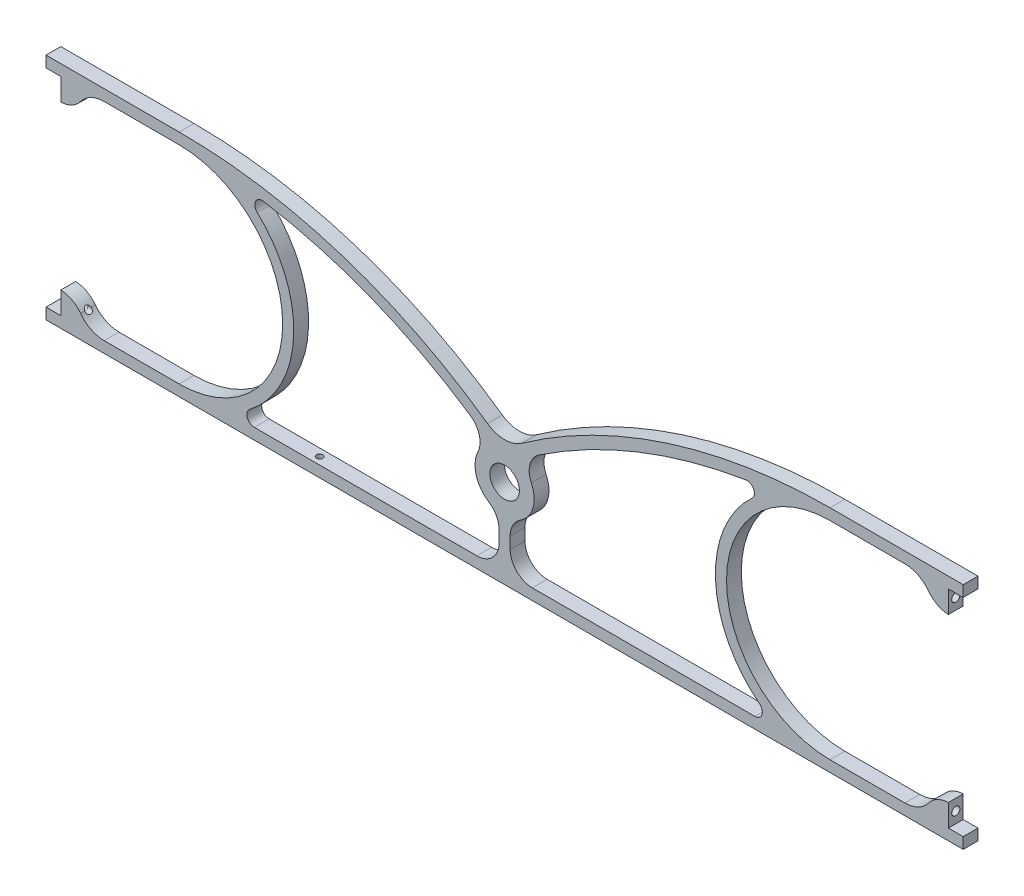
from build123d import *

# Parameters (mm, degrees)
SKETCH1_W                      = 6.35
SKETCH1_H                      = 4.7625
SKETCH1_R                      = 12.7
SKETCH1_R_2                    = 6.35
BOSS_EXTRUDE1_DEPTH            = 6.35
SKETCH2_W                      = 6.35
SKETCH2_H                      = 9.525
BOSS_EXTRUDE2_DEPTH            = 6.35
FILLET1_R                      = 12.7
FILLET2_R                      = 11.1125
F_6_32_TAPPED_HOLE1_D          = 2.7051
F_6_32_TAPPED_HOLE1_DEPTH      = 9.398
F_6_32_TAPPED_HOLE1_TIP        = 0.81269403
FILLET3_R                      = 9.525
FILLET4_R                      = 12.7
F_6_32_TAPPED_HOLE2_AT_2_COUNT = 2
F_6_32_TAPPED_HOLE2_AT_2_PITCH = 79.375
FILLET5_R                      = 3.175


with BuildPart() as part:
    # Sketch1 → Boss-Extrude1 (new body)
    # profile 1 of 11: a face of its own
    with BuildSketch(Plane.XY):
        with Locations((-193.675, -35.71875)):
            Rectangle(SKETCH1_W, SKETCH1_H)
    # profile 2 of 11: a face of its own
    with BuildSketch(Plane.XY):
        with Locations((-193.675, 57.94375)):
            Rectangle(SKETCH1_W, SKETCH1_H)
    # profile 3 of 11: a face of its own
    with BuildSketch(Plane.XY):
        with BuildLine():
            Line((-190.5, 55.5625), (-139.7, 55.5625))
            ThreePointArc((-139.7, 55.5625), (-127.904529217, 55.251640636), (-116.141805402, 54.31992556))
            ThreePointArc((-116.141805402, 54.31992556), (-58.142540048, 40.183298939), (-5.938839164, 11.225871431))
            ThreePointArc((-5.938839164, 11.225871431), (-3.059528789, 12.325959743), (0, 12.7))
            ThreePointArc((0, 12.7), (-65.90259045, 48.091568013), (-139.7, 60.325))
            Line((-139.7, 60.325), (-190.5, 60.325))
            Line((-190.5, 60.325), (-190.5, 55.5625))
        make_face()
    # profile 4 of 11: a face of its own
    with BuildSketch(Plane.XY):
        with BuildLine():
            ThreePointArc((-139.7, 55.5625), (-95.25, 11.1125), (-139.7, -33.3375))
            Line((-139.7, -33.3375), (-118.579686171, -33.3375))
            ThreePointArc((-118.579686171, -33.3375), (-90.506521339, 9.744357657), (-116.141805402, 54.31992556))
            ThreePointArc((-116.141805402, 54.31992556), (-127.904529217, 55.251640636), (-139.7, 55.5625))
        make_face()
    # profile 5 of 11: a face of its own
    with BuildSketch(Plane.XY):
        Polygon((190.5, -38.1), (190.5, -33.3375), (-118.579686171, -33.3375), (-190.5, -33.3375), (-190.5, -38.1), align=None)
    # profile 6 of 11: a face of its own
    with BuildSketch(Plane.XY):
        Circle(SKETCH1_R)
        Circle(SKETCH1_R_2, mode=Mode.SUBTRACT)
    # profile 7 of 11: a face of its own
    with BuildSketch(Plane.XY):
        with BuildLine():
            Line((-2.38125, -33.3375), (2.38125, -33.3375))
            Line((2.38125, -33.3375), (2.38125, -12.474760456))
            ThreePointArc((2.38125, -12.474760456), (0, -12.7), (-2.38125, -12.474760456))
            Line((-2.38125, -12.474760456), (-2.38125, -33.3375))
        make_face()
    # profile 8 of 11: a face of its own
    with BuildSketch(Plane.XY):
        with BuildLine():
            ThreePointArc((116.141805402, 54.31992556), (127.904529217, 55.251640636), (139.7, 55.5625))
            Line((139.7, 55.5625), (190.5, 55.5625))
            Line((190.5, 55.5625), (190.5, 60.325))
            Line((190.5, 60.325), (139.7, 60.325))
            ThreePointArc((139.7, 60.325), (65.90259045, 48.091568013), (0, 12.7))
            ThreePointArc((0, 12.7), (3.059528789, 12.325959743), (5.938839164, 11.225871431))
            ThreePointArc((5.938839164, 11.225871431), (58.142540048, 40.183298939), (116.141805402, 54.31992556))
        make_face()
    # profile 9 of 11: a face of its own
    with BuildSketch(Plane.XY):
        with BuildLine():
            Line((118.579686171, -33.3375), (139.7, -33.3375))
            ThreePointArc((139.7, -33.3375), (95.25, 11.1125), (139.7, 55.5625))
            ThreePointArc((139.7, 55.5625), (127.904529217, 55.251640636), (116.141805402, 54.31992556))
            ThreePointArc((116.141805402, 54.31992556), (90.506521339, 9.744357657), (118.579686171, -33.3375))
        make_face()
    # profile 10 of 11: a face of its own
    with BuildSketch(Plane.XY):
        with Locations((193.675, 57.94375)):
            Rectangle(SKETCH1_W, SKETCH1_H)
    # profile 11 of 11: a face of its own
    with BuildSketch(Plane.XY):
        with Locations((193.675, -35.71875)):
            Rectangle(SKETCH1_W, SKETCH1_H)
    extrude(amount=-BOSS_EXTRUDE1_DEPTH)

    # Sketch2 → Boss-Extrude2 (add)
    with BuildSketch(Plane.XY):
        with Locations((-187.325, -28.575)):
            Rectangle(SKETCH2_W, SKETCH2_H)
        with Locations((-187.325, 50.8)):
            Rectangle(SKETCH2_W, SKETCH2_H)
        with Locations((187.325, 50.8)):
            Rectangle(SKETCH2_W, SKETCH2_H)
        with Locations((187.325, -28.575)):
            Rectangle(SKETCH2_W, SKETCH2_H)
    extrude(amount=-BOSS_EXTRUDE2_DEPTH)

    # Fillet1
    # the kernel refuses this fillet: 12.7 mm, written as the material it adds along each edge
    with BuildSketch(Plane(origin=(184.15, -33.3375, 0), x_dir=(-1, 0, 0), z_dir=(0, 0, -1)), Plane(origin=(-184.15, 55.5625, 0), x_dir=(1, 0, 0), z_dir=(0, 0, -1))) as fillet1_piece_1:
        with BuildLine():
            CenterArc((12.296722124, 12.7), FILLET1_R, 194.477512186, 75.522487814)
            Line((0, 9.525), (-0.245934442, 9.4615))
            ThreePointArc((-0.245934442, 9.4615), (-0.254, 4.7625), (-0.254, 0))
            Line((-0.254, 0), (0, -0.254))
            Line((0, -0.254), (12.296722124, -0.254))
            Line((12.296722124, -0.254), (12.296722124, 0))
        make_face()
    extrude(amount=6.35)
    with BuildSketch(Plane(origin=(184.15, 55.5625, 0), x_dir=(-1, 0, 0), z_dir=(0, 0, -1)), Plane(origin=(-184.15, -33.3375, 0), x_dir=(1, 0, 0), z_dir=(0, 0, -1))) as fillet1_piece_2:
        with BuildLine():
            CenterArc((12.296722124, -12.7), FILLET1_R, 90, 75.522487814)
            Line((0, -9.525), (-0.245934442, -9.4615))
            ThreePointArc((-0.245934442, -9.4615), (-0.254, -4.7625), (-0.254, 0))
            Line((-0.254, 0), (0, 0.254))
            Line((0, 0.254), (12.296722124, 0.254))
            Line((12.296722124, 0.254), (12.296722124, 0))
        make_face()
    extrude(amount=6.35)

    # Fillet2
    # the kernel refuses this fillet: 11.1125 mm, written as the material it takes off along each edge
    with BuildSketch(Plane(origin=(184.15, -23.8125, 15.875), x_dir=(1, 0, 0), z_dir=(0, 0, -1))) as fillet2_piece_1:
        with BuildLine():
            CenterArc((6.758920293, 11.10497368), FILLET2_R, 216.847264444, 51.043876357)
            Line((-2.133712835, 4.440985963), (-2.311565498, 4.307706209))
            ThreePointArc((-2.311565498, 4.307706209), (-1.049758647, 2.228707764), (-0.215192637, -0.0555625))
            Line((-0.215192637, -0.0555625), (0, -0.22225))
            ThreePointArc((0, -0.22225), (3.175, -0.22225), (6.341821594, -0.222099474))
            Line((6.341821594, -0.222099474), (6.35, 0))
        make_face()
    extrude(amount=38.1, mode=Mode.SUBTRACT)
    with BuildSketch(Plane(origin=(184.15, 46.0375, 15.875), x_dir=(-0.43306748122172517, 0.9013615016785834, 0), z_dir=(0, 0, -1))) as fillet2_piece_2:
        with BuildLine():
            CenterArc((7.082527166, 10.901433526), FILLET2_R, 207.771247513, 51.043876357)
            Line((-2.749978506, 5.723645536), (-2.946628619, 5.620089776))
            ThreePointArc((-2.946628619, 5.620089776), (-1.575316847, 2.76557352), (-0.200327594, -0.096249248))
            Line((-0.200327594, -0.096249248), (0.043111035, -0.218028671))
            ThreePointArc((0.043111035, -0.218028671), (2.46348771, 0.018968828), (4.883864385, -0.218028671))
            Line((4.883864385, -0.218028671), (4.92697542, 0))
        make_face()
    extrude(amount=38.1, mode=Mode.SUBTRACT)
    with BuildSketch(Plane(origin=(-184.15, -23.8125, 15.875), x_dir=(-1, 0, 0), z_dir=(0, 0, -1))) as fillet2_piece_3:
        with BuildLine():
            CenterArc((6.758920293, -11.10497368), FILLET2_R, 92.108859198, 51.043876357)
            Line((-2.133712835, -4.440985963), (-2.311565498, -4.307706209))
            ThreePointArc((-2.311565498, -4.307706209), (-1.049758647, -2.228707764), (-0.215192637, 0.0555625))
            Line((-0.215192637, 0.0555625), (0, 0.22225))
            ThreePointArc((0, 0.22225), (3.175, 0.22225), (6.341821594, 0.222099474))
            Line((6.341821594, 0.222099474), (6.35, 0))
        make_face()
    extrude(amount=38.1, mode=Mode.SUBTRACT)
    with BuildSketch(Plane(origin=(-184.15, 46.0375, 15.875), x_dir=(0.43306748122172517, 0.9013615016785834, 0), z_dir=(0, 0, -1))) as fillet2_piece_4:
        with BuildLine():
            CenterArc((7.082527166, -10.901433526), FILLET2_R, 101.184876129, 51.043876357)
            Line((-2.749978506, -5.723645536), (-2.946628619, -5.620089776))
            ThreePointArc((-2.946628619, -5.620089776), (-1.575316847, -2.76557352), (-0.200327594, 0.096249248))
            Line((-0.200327594, 0.096249248), (0.043111035, 0.218028671))
            ThreePointArc((0.043111035, 0.218028671), (2.46348771, -0.018968828), (4.883864385, 0.218028671))
            Line((4.883864385, 0.218028671), (4.92697542, 0))
        make_face()
    extrude(amount=38.1, mode=Mode.SUBTRACT)

    # #6-32 Tapped Hole1
    with Locations(Plane(origin=(0, -38.1, 0), x_dir=(-1, 0, 0), z_dir=(0, -1, 0))):
        with Locations((82.55, 3.175)):
            Hole(F_6_32_TAPPED_HOLE1_D / 2, depth=F_6_32_TAPPED_HOLE1_DEPTH)
            with Locations((0, 0, -(F_6_32_TAPPED_HOLE1_DEPTH + F_6_32_TAPPED_HOLE1_TIP / 2))):  # 118° drill point
                Cone(0, F_6_32_TAPPED_HOLE1_D / 2, F_6_32_TAPPED_HOLE1_TIP, mode=Mode.SUBTRACT)

    # Fillet3
    fillet3_edges = [part.edges().sort_by_distance(p)[0] for p in [
        (2.38125, -12.474760456, -3.175),
        (2.38125, -33.3375, -3.175),
        (5.938839164, 11.225871431, -3.175),
        (-2.38125, -33.3375, -3.175),
        (-2.38125, -12.474760456, -3.175),
        (-5.938839164, 11.225871431, -3.175),
    ]]
    fillet(fillet3_edges, radius=FILLET3_R)

    # Fillet4
    fillet4_edges = [part.edges().sort_by_distance(p)[0] for p in [
        (0, 12.7, -3.175),
    ]]
    fillet(fillet4_edges, radius=FILLET4_R)

    # Sketch12 → #6-32 Tapped Hole2 (revolve, cut)
    with BuildSketch(Plane(origin=(190.5, -28.575, -3.175), x_dir=(0, 0, -1), z_dir=(0, 1, 0))):
        Polygon((0, 0), (0, 10.21069403), (1.35255, 9.398), (1.35255, 7.112), (1.7526, 7.112), (1.7526, 0), align=None)
    f_6_32_tapped_hole2 = revolve(axis=Axis((196.85, -28.575, -3.175), (-1, 0, 0)), mode=Mode.SUBTRACT)

    # #6-32 Tapped Hole2 at 2: #6-32 Tapped Hole2 ×2
    with Locations(*[(0, i * F_6_32_TAPPED_HOLE2_AT_2_PITCH, 0) for i in range(1, F_6_32_TAPPED_HOLE2_AT_2_COUNT)]):
        add(f_6_32_tapped_hole2, mode=Mode.SUBTRACT)

    # Mirror1: #6-32 Tapped Hole2 across plane
    add(f_6_32_tapped_hole2.mirror(Plane(origin=(0, 0, 0), x_dir=(0, 0, 1), z_dir=(1, 0, 0))), mode=Mode.SUBTRACT)

    # Mirror1 copy 1 sketch → Mirror1 copy 1 (revolve, cut)
    with BuildSketch(Plane(origin=(-190.5, 50.8, -3.175), x_dir=(0, 0, -1), z_dir=(0, 1, 0))):
        Polygon((0, 0), (0, -10.21069403), (1.35255, -9.398), (1.35255, -7.112), (1.7526, -7.112), (1.7526, 0), align=None)
    revolve(axis=Axis((-196.85, 50.8, -3.175), (-1, 0, 0)), mode=Mode.SUBTRACT)

    # Fillet5
    fillet5_edges = [part.edges().sort_by_distance(p)[0] for p in [
        (118.579686171, -33.3375, -3.175),
        (116.141805402, 54.31992556, -3.175),
        (-116.141805402, 54.31992556, -3.175),
        (-118.579686171, -33.3375, -3.175),
    ]]
    fillet(fillet5_edges, radius=FILLET5_R)


solid = part.part
